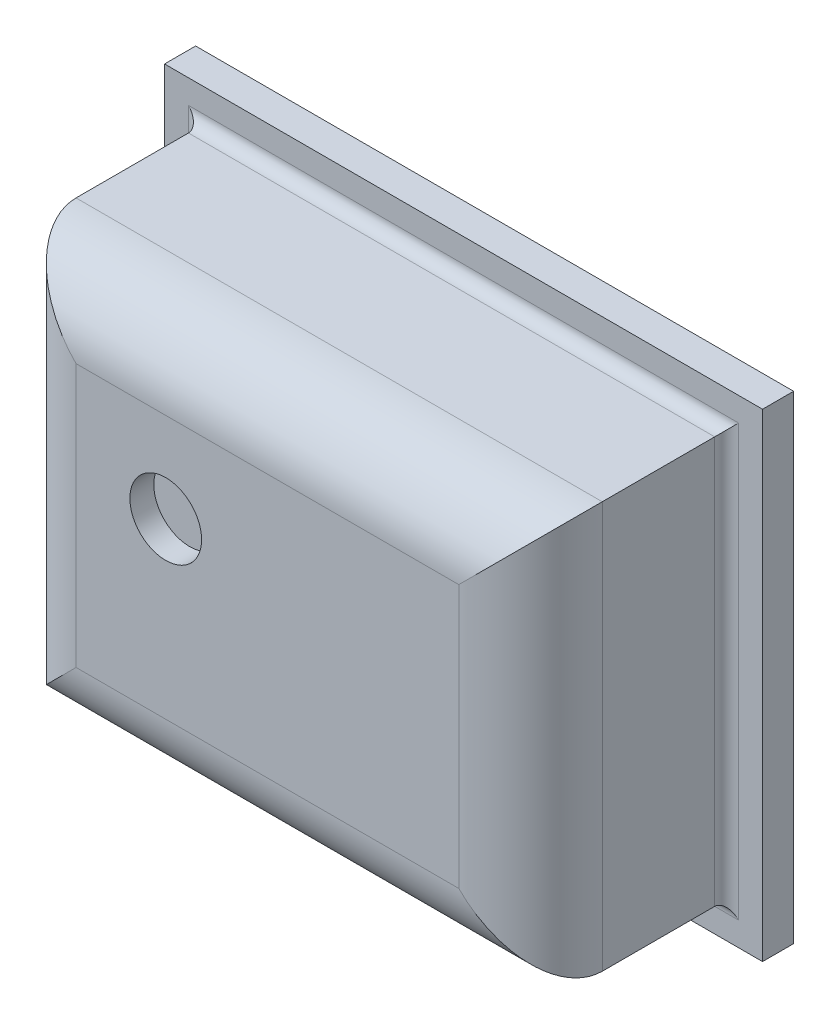
from build123d import *

# Parameters (mm, degrees)
ESQUISSE1_W             = 2.5
ESQUISSE1_H             = 2
BOSS_EXTRU_1_DEPTH      = 0.13
ESQUISSE2_W             = 2.2
ESQUISSE2_H             = 1.7
BOSS_EXTRU_2_DEPTH      = 0.82
CONG_1_R                = 0.3
ESQUISSE3_R             = 0.15
ENL_V_MAT_EXTRU_1_DEPTH = 0.1
CONG_2_R                = 0.05


with BuildPart() as part:
    # Esquisse1 → Boss.-Extru.1 (new body)
    with BuildSketch(Plane.XY):
        Rectangle(ESQUISSE1_W, ESQUISSE1_H)
    extrude(amount=BOSS_EXTRU_1_DEPTH)

    # Esquisse2 → Boss.-Extru.2 (add)
    with BuildSketch(Plane.XY.offset(0.13)):
        Rectangle(ESQUISSE2_W, ESQUISSE2_H)
    extrude(amount=BOSS_EXTRU_2_DEPTH)

    # Congé1
    cong_1_edges = [part.edges().sort_by_distance(p)[0] for p in [
        (0, -0.85, 0.95),
        (-1.1, 0, 0.95),
        (0, 0.85, 0.95),
        (1.1, 0, 0.95),
    ]]
    fillet(cong_1_edges, radius=CONG_1_R)

    # Esquisse3 → Enlèv. mat.-Extru.1 (cut)
    with BuildSketch(Plane.XY.offset(0.95)):
        with Locations((-0.425, 0.175)):
            Circle(ESQUISSE3_R)
    extrude(amount=-ENL_V_MAT_EXTRU_1_DEPTH, mode=Mode.SUBTRACT)

    # Congé2
    cong_2_edges = [part.edges().sort_by_distance(p)[0] for p in [
        (0, 0.85, 0.13),
        (1.1, 0, 0.13),
        (-1.1, 0, 0.13),
        (0, -0.85, 0.13),
    ]]
    fillet(cong_2_edges, radius=CONG_2_R)


solid = part.part
